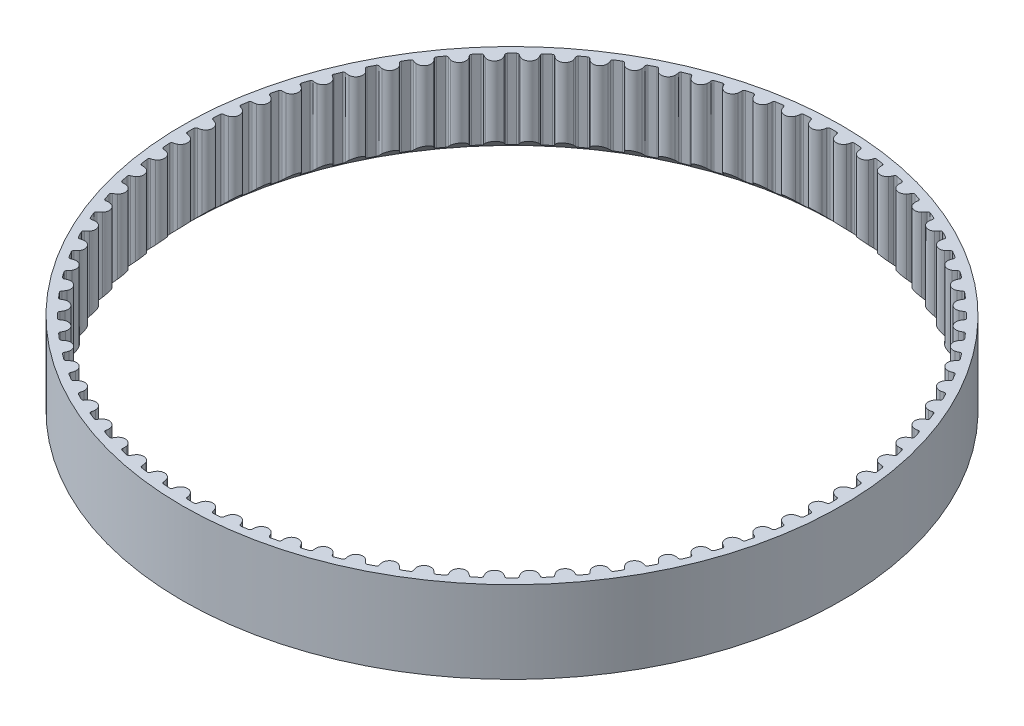
from build123d import *

# Parameters (mm, degrees)
BOSS_EXTRUDE3_OUTLINE_R = 26.0947905
BOSS_EXTRUDE3_DEPTH     = 6.5


# Read off the part's stored shape, not the designer's step: Boss-Extrude3
with BuildPart() as part:
    # Boss-Extrude3 outline → Boss-Extrude3 (new body)
    with BuildSketch(Plane(origin=(0, 0, 0), x_dir=(1, 0, 0), z_dir=(0, 1, 0))):
        Circle(BOSS_EXTRUDE3_OUTLINE_R)
        with BuildLine():
            ThreePointArc((-0.406440415, 25.311470509), (-0.357672827, 25.405419773), (-0.259013796, 25.443775182))
            ThreePointArc((-0.259013796, 25.443775182), (1.5e-08, 25.445093509), (0.259013826, 25.443775182))
            ThreePointArc((0.259013826, 25.443775182), (0.357672858, 25.405419773), (0.406440446, 25.311470509))
            ThreePointArc((0.406440446, 25.311470509), (0.434680636, 25.166341424), (0.484010949, 25.026962516))
            ThreePointArc((0.484010949, 25.026962516), (0.970298137, 24.695736292), (1.481073973, 24.987787803))
            ThreePointArc((1.481073973, 24.987787803), (1.541187761, 25.12286664), (1.580727593, 25.26533264))
            ThreePointArc((1.580727593, 25.26533264), (1.636716021, 25.355166029), (1.73808025, 25.385662503))
            ThreePointArc((1.73808025, 25.385662503), (1.996399043, 25.366654776), (2.254510966, 25.345018524))
            ThreePointArc((2.254510966, 25.345018524), (2.349856534, 25.299040654), (2.391102613, 25.201554743))
            ThreePointArc((2.391102613, 25.201554743), (2.407869051, 25.054657343), (2.446111753, 24.911837682))
            ThreePointArc((2.446111753, 24.911837682), (2.904912169, 24.543478864), (3.437027552, 24.794555068))
            ThreePointArc((3.437027552, 24.794555068), (3.507554192, 24.924501028), (3.55814989, 25.063425594))
            ThreePointArc((3.55814989, 25.063425594), (3.62101397, 25.148589255), (3.724458453, 25.171038773))
            ThreePointArc((3.724458453, 25.171038773), (3.980489606, 25.131822182), (4.236108296, 25.090001399))
            ThreePointArc((4.236108296, 25.090001399), (4.327552563, 25.036684536), (4.361022838, 24.936263011))
            ThreePointArc((4.361022838, 24.936263011), (4.366212154, 24.788502967), (4.393131464, 24.643123084))
            ThreePointArc((4.393131464, 24.643123084), (4.821616452, 24.239902728), (5.371790712, 24.448455656))
            ThreePointArc((5.371790712, 24.448455656), (5.452295385, 24.57246758), (5.513635009, 24.706994195))
            ThreePointArc((5.513635009, 24.706994195), (5.582987165, 24.786963066), (5.687874132, 24.801227218))
            ThreePointArc((5.687874132, 24.801227218), (5.940039128, 24.742043546), (6.191588609, 24.680296071))
            ThreePointArc((6.191588609, 24.680296071), (6.278567791, 24.619968932), (6.304055906, 24.517230926))
            ThreePointArc((6.304055906, 24.517230926), (6.297636106, 24.369519228), (6.313066059, 24.222475438))
            ThreePointArc((6.313066059, 24.222475438), (6.708593866, 23.78687953), (7.273434997, 23.951623384))
            ThreePointArc((7.273434997, 23.951623384), (7.363421364, 24.068936697), (7.435126735, 24.19823596))
            ThreePointArc((7.435126735, 24.19823596), (7.510539386, 24.272517007), (7.616222174, 24.278507851))
            ThreePointArc((7.616222174, 24.278507851), (7.862966332, 24.199721984), (8.10889572, 24.118428512))
            ThreePointArc((8.10889572, 24.118428512), (8.190873561, 24.051463033), (8.208222374, 23.94704196))
            ThreePointArc((8.208222374, 23.94704196), (8.190233037, 23.800289299), (8.194078503, 23.652488176))
            ThreePointArc((8.194078503, 23.652488176), (8.554210568, 23.187202311), (9.130236136, 23.30712139))
            ThreePointArc((9.130236136, 23.30712139), (9.229149402, 23.417012816), (9.310778432, 23.540287554))
            ThreePointArc((9.310778432, 23.540287554), (9.391786635, 23.608422809), (9.497613675, 23.606103409))
            ThreePointArc((9.497613675, 23.606103409), (9.737415735, 23.50820109), (9.976208792, 23.40786282))
            ThreePointArc((9.976208792, 23.40786282), (10.052679872, 23.334671866), (10.061782421, 23.229211516))
            ThreePointArc((10.061782421, 23.229211516), (10.032334459, 23.084322672), (10.024571727, 22.936675459))
            ThreePointArc((10.024571727, 22.936675459), (10.347087718, 22.444568279), (10.930746334, 22.518923242))
            ThreePointArc((10.930746334, 22.518923242), (11.037976665, 22.620715264), (11.129026084, 22.737205448))
            ThreePointArc((11.129026084, 22.737205448), (11.215130397, 22.798774833), (11.320449229, 22.78815949))
            ThreePointArc((11.320449229, 22.78815949), (11.551830732, 22.671744318), (11.782015219, 22.552979871))
            ThreePointArc((11.782015219, 22.552979871), (11.852508069, 22.474014688), (11.853308234, 22.368165259))
            ThreePointArc((11.853308234, 22.368165259), (11.812583202, 22.226033519), (11.793260133, 22.07945051))
            ThreePointArc((11.793260133, 22.07945051), (12.076171631, 21.56355602), (12.663864845, 21.591888444))
            ThreePointArc((12.663864845, 21.591888444), (12.778751131, 21.684953481), (12.87865959, 21.793940908))
            ThreePointArc((12.87865959, 21.793940908), (12.969329149, 21.84856483), (13.073490448, 21.82971899))
            ThreePointArc((13.073490448, 21.82971899), (13.29502485, 21.695508703), (13.515181605, 21.5590503))
            ThreePointArc((13.515181605, 21.5590503), (13.579261612, 21.474797736), (13.57175446, 21.369211825))
            ThreePointArc((13.57175446, 21.369211825), (13.520003442, 21.230713479), (13.489239169, 21.086098407))
            ThreePointArc((13.489239169, 21.086098407), (13.73080193, 20.549597267), (14.318906418, 20.531732474))
            ThreePointArc((14.318906418, 20.531732474), (14.440740346, 20.615496747), (14.548891876, 20.716309476))
            ThreePointArc((14.548891876, 20.716309476), (14.643567675, 20.763651159), (14.745929252, 20.736691013))
            ThreePointArc((14.745929252, 20.736691013), (14.95625072, 20.585513063), (15.165022402, 20.432202016))
            ThreePointArc((15.165022402, 20.432202016), (15.222294491, 20.343181514), (15.206526307, 20.238510094))
            ThreePointArc((15.206526307, 20.238510094), (15.144068365, 20.10449903), (15.10205256, 19.962743495))
            ThreePointArc((15.10205256, 19.962743495), (15.300777269, 19.408943414), (15.885667172, 19.344991545))
            ThreePointArc((15.885667172, 19.344991545), (16.013697596, 19.418938622), (16.129425407, 19.510955107))
            ThreePointArc((16.129425407, 19.510955107), (16.227523738, 19.550722674), (16.327454499, 19.51581444))
            ThreePointArc((16.327454499, 19.51581444), (16.525266331, 19.348600889), (16.721365793, 19.179382412))
            ThreePointArc((16.721365793, 19.179382412), (16.771476863, 19.086142815), (16.747544862, 18.983031219))
            ThreePointArc((16.747544862, 18.983031219), (16.67476507, 18.85433366), (16.621756775, 18.716311632))
            ThreePointArc((16.621756775, 18.716311632), (16.776418228, 18.14862697), (17.354487505, 18.038982311))
            ThreePointArc((17.354487505, 18.038982311), (17.487925075, 18.102656282), (17.610515665, 18.185309212))
            ThreePointArc((17.610515665, 18.185309212), (17.711431719, 18.217257482), (17.808315559, 18.174616382))
            ThreePointArc((17.808315559, 18.174616382), (17.992398179, 17.992398157), (18.174616403, 17.808315537))
            ThreePointArc((18.174616403, 17.808315537), (18.217257504, 17.711431697), (18.185309234, 17.610515643))
            ThreePointArc((18.185309234, 17.610515643), (18.102656304, 17.487925053), (18.038982332, 17.354487483))
            ThreePointArc((18.038982332, 17.354487483), (18.14862699, 16.776418206), (18.716311652, 16.621756752))
            ThreePointArc((18.716311652, 16.621756752), (18.854333681, 16.674765047), (18.983031239, 16.747544839))
            ThreePointArc((18.983031239, 16.747544839), (19.086142835, 16.77147684), (19.179382432, 16.72136577))
            ThreePointArc((19.179382432, 16.72136577), (19.348600909, 16.525266307), (19.51581446, 16.327454475))
            ThreePointArc((19.51581446, 16.327454475), (19.550722693, 16.227523714), (19.510955127, 16.129425383))
            ThreePointArc((19.510955127, 16.129425383), (19.418938642, 16.013697573), (19.344991565, 15.885667149))
            ThreePointArc((19.344991565, 15.885667149), (19.408943432, 15.300777245), (19.962743514, 15.102052536))
            ThreePointArc((19.962743514, 15.102052536), (20.104499049, 15.14406834), (20.238510113, 15.206526282))
            ThreePointArc((20.238510113, 15.206526282), (20.343181533, 15.222294467), (20.432202034, 15.165022377))
            ThreePointArc((20.432202034, 15.165022377), (20.585513081, 14.956250695), (20.736691031, 14.745929227))
            ThreePointArc((20.736691031, 14.745929227), (20.763651177, 14.64356765), (20.716309494, 14.548891851))
            ThreePointArc((20.716309494, 14.548891851), (20.615496765, 14.440740322), (20.531732491, 14.318906393))
            ThreePointArc((20.531732491, 14.318906393), (20.549597284, 13.730801905), (21.086098423, 13.489239144))
            ThreePointArc((21.086098423, 13.489239144), (21.230713496, 13.520003416), (21.369211842, 13.571754434))
            ThreePointArc((21.369211842, 13.571754434), (21.474797753, 13.579261586), (21.559050317, 13.515181579))
            ThreePointArc((21.559050317, 13.515181579), (21.695508719, 13.295024824), (21.829719005, 13.073490422))
            ThreePointArc((21.829719005, 13.073490422), (21.848564846, 12.969329123), (21.793940924, 12.878659563))
            ThreePointArc((21.793940924, 12.878659563), (21.684953496, 12.778751104), (21.59188846, 12.663864819))
            ThreePointArc((21.59188846, 12.663864819), (21.563556034, 12.076171605), (22.079450524, 11.793260107))
            ThreePointArc((22.079450524, 11.793260107), (22.226033534, 11.812583175), (22.368165274, 11.853308207))
            ThreePointArc((22.368165274, 11.853308207), (22.474014703, 11.852508041), (22.552979885, 11.782015192))
            ThreePointArc((22.552979885, 11.782015192), (22.671744332, 11.551830704), (22.788159504, 11.320449201))
            ThreePointArc((22.788159504, 11.320449201), (22.798774847, 11.215130369), (22.737205461, 11.129026057))
            ThreePointArc((22.737205461, 11.129026057), (22.620715278, 11.037976637), (22.518923256, 10.930746306))
            ThreePointArc((22.518923256, 10.930746306), (22.444568291, 10.34708769), (22.936675471, 10.024571699))
            ThreePointArc((22.936675471, 10.024571699), (23.084322684, 10.032334431), (23.229211528, 10.061782393))
            ThreePointArc((23.229211528, 10.061782393), (23.334671878, 10.052679844), (23.407862832, 9.976208763))
            ThreePointArc((23.407862832, 9.976208763), (23.508201102, 9.737415706), (23.606103421, 9.497613646))
            ThreePointArc((23.606103421, 9.497613646), (23.60842282, 9.391786607), (23.540287566, 9.310778404))
            ThreePointArc((23.540287566, 9.310778404), (23.417012828, 9.229149373), (23.307121401, 9.130236108))
            ThreePointArc((23.307121401, 9.130236108), (23.187202321, 8.55421054), (23.652488186, 8.194078474))
            ThreePointArc((23.652488186, 8.194078474), (23.800289309, 8.190233009), (23.947041969, 8.208222345))
            ThreePointArc((23.947041969, 8.208222345), (24.051463043, 8.190873532), (24.118428522, 8.10889569))
            ThreePointArc((24.118428522, 8.10889569), (24.199721994, 7.862966303), (24.27850786, 7.616222145))
            ThreePointArc((24.27850786, 7.616222145), (24.272517016, 7.510539357), (24.198235969, 7.435126706))
            ThreePointArc((24.198235969, 7.435126706), (24.068936706, 7.363421335), (23.951623393, 7.273434968))
            ThreePointArc((23.951623393, 7.273434968), (23.786879539, 6.708593838), (24.222475445, 6.31306603))
            ThreePointArc((24.222475445, 6.31306603), (24.369519235, 6.297636076), (24.517230934, 6.304055877))
            ThreePointArc((24.517230934, 6.304055877), (24.61996894, 6.278567761), (24.680296079, 6.191588579))
            ThreePointArc((24.680296079, 6.191588579), (24.742043553, 5.940039097), (24.801227225, 5.687874101))
            ThreePointArc((24.801227225, 5.687874101), (24.786963073, 5.582987134), (24.706994201, 5.513634979))
            ThreePointArc((24.706994201, 5.513634979), (24.572467586, 5.452295355), (24.448455662, 5.371790683))
            ThreePointArc((24.448455662, 5.371790683), (24.239902734, 4.821616423), (24.643123089, 4.393131434))
            ThreePointArc((24.643123089, 4.393131434), (24.788502972, 4.366212123), (24.936263016, 4.361022807))
            ThreePointArc((24.936263016, 4.361022807), (25.036684541, 4.327552532), (25.090001404, 4.236108265))
            ThreePointArc((25.090001404, 4.236108265), (25.131822186, 3.980489576), (25.171038777, 3.724458423))
            ThreePointArc((25.171038777, 3.724458423), (25.14858926, 3.62101394), (25.063425599, 3.558149859))
            ThreePointArc((25.063425599, 3.558149859), (24.924501033, 3.507554162), (24.794555072, 3.437027521))
            ThreePointArc((24.794555072, 3.437027521), (24.543478868, 2.904912139), (24.911837685, 2.446111723))
            ThreePointArc((24.911837685, 2.446111723), (25.054657346, 2.407869021), (25.201554746, 2.391102582))
            ThreePointArc((25.201554746, 2.391102582), (25.299040657, 2.349856503), (25.345018527, 2.254510935))
            ThreePointArc((25.345018527, 2.254510935), (25.366654779, 1.996399012), (25.385662505, 1.738080219))
            ThreePointArc((25.385662505, 1.738080219), (25.355166031, 1.63671599), (25.265332642, 1.580727562))
            ThreePointArc((25.265332642, 1.580727562), (25.122866642, 1.54118773), (24.987787805, 1.481073943))
            ThreePointArc((24.987787805, 1.481073943), (24.695736293, 0.970298107), (25.026962517, 0.484010919))
            ThreePointArc((25.026962517, 0.484010919), (25.166341424, 0.434680605), (25.311470509, 0.406440415))
            ThreePointArc((25.311470509, 0.406440415), (25.405419773, 0.357672827), (25.443775182, 0.259013796))
            ThreePointArc((25.443775182, 0.259013796), (25.445093509, -1.5e-08), (25.443775182, -0.259013826))
            ThreePointArc((25.443775182, -0.259013826), (25.405419773, -0.357672858), (25.311470509, -0.406440446))
            ThreePointArc((25.311470509, -0.406440446), (25.166341424, -0.434680636), (25.026962516, -0.484010949))
            ThreePointArc((25.026962516, -0.484010949), (24.695736292, -0.970298137), (24.987787803, -1.481073973))
            ThreePointArc((24.987787803, -1.481073973), (25.12286664, -1.541187761), (25.26533264, -1.580727593))
            ThreePointArc((25.26533264, -1.580727593), (25.355166029, -1.636716021), (25.385662503, -1.73808025))
            ThreePointArc((25.385662503, -1.73808025), (25.366654776, -1.996399043), (25.345018524, -2.254510966))
            ThreePointArc((25.345018524, -2.254510966), (25.299040654, -2.349856534), (25.201554743, -2.391102613))
            ThreePointArc((25.201554743, -2.391102613), (25.054657343, -2.407869051), (24.911837682, -2.446111753))
            ThreePointArc((24.911837682, -2.446111753), (24.543478864, -2.904912169), (24.794555068, -3.437027552))
            ThreePointArc((24.794555068, -3.437027552), (24.924501028, -3.507554192), (25.063425594, -3.55814989))
            ThreePointArc((25.063425594, -3.55814989), (25.148589255, -3.62101397), (25.171038773, -3.724458453))
            ThreePointArc((25.171038773, -3.724458453), (25.131822182, -3.980489606), (25.090001399, -4.236108296))
            ThreePointArc((25.090001399, -4.236108296), (25.036684536, -4.327552563), (24.936263011, -4.361022838))
            ThreePointArc((24.936263011, -4.361022838), (24.788502967, -4.366212154), (24.643123084, -4.393131464))
            ThreePointArc((24.643123084, -4.393131464), (24.239902728, -4.821616452), (24.448455656, -5.371790712))
            ThreePointArc((24.448455656, -5.371790712), (24.57246758, -5.452295385), (24.706994195, -5.513635009))
            ThreePointArc((24.706994195, -5.513635009), (24.786963066, -5.582987165), (24.801227218, -5.687874132))
            ThreePointArc((24.801227218, -5.687874132), (24.742043546, -5.940039128), (24.680296071, -6.191588609))
            ThreePointArc((24.680296071, -6.191588609), (24.619968932, -6.278567791), (24.517230926, -6.304055906))
            ThreePointArc((24.517230926, -6.304055906), (24.369519228, -6.297636106), (24.222475438, -6.313066059))
            ThreePointArc((24.222475438, -6.313066059), (23.78687953, -6.708593866), (23.951623384, -7.273434997))
            ThreePointArc((23.951623384, -7.273434997), (24.068936697, -7.363421364), (24.19823596, -7.435126735))
            ThreePointArc((24.19823596, -7.435126735), (24.272517007, -7.510539386), (24.278507851, -7.616222174))
            ThreePointArc((24.278507851, -7.616222174), (24.199721984, -7.862966332), (24.118428512, -8.10889572))
            ThreePointArc((24.118428512, -8.10889572), (24.051463033, -8.190873561), (23.94704196, -8.208222374))
            ThreePointArc((23.94704196, -8.208222374), (23.800289299, -8.190233037), (23.652488176, -8.194078503))
            ThreePointArc((23.652488176, -8.194078503), (23.187202311, -8.554210568), (23.30712139, -9.130236136))
            ThreePointArc((23.30712139, -9.130236136), (23.417012816, -9.229149402), (23.540287554, -9.310778432))
            ThreePointArc((23.540287554, -9.310778432), (23.608422809, -9.391786635), (23.606103409, -9.497613675))
            ThreePointArc((23.606103409, -9.497613675), (23.50820109, -9.737415735), (23.40786282, -9.976208792))
            ThreePointArc((23.40786282, -9.976208792), (23.334671866, -10.052679872), (23.229211516, -10.061782421))
            ThreePointArc((23.229211516, -10.061782421), (23.084322672, -10.032334459), (22.936675459, -10.024571727))
            ThreePointArc((22.936675459, -10.024571727), (22.444568279, -10.347087718), (22.518923242, -10.930746334))
            ThreePointArc((22.518923242, -10.930746334), (22.620715264, -11.037976665), (22.737205448, -11.129026084))
            ThreePointArc((22.737205448, -11.129026084), (22.798774833, -11.215130397), (22.78815949, -11.320449229))
            ThreePointArc((22.78815949, -11.320449229), (22.671744318, -11.551830732), (22.552979871, -11.782015219))
            ThreePointArc((22.552979871, -11.782015219), (22.474014688, -11.852508069), (22.368165259, -11.853308234))
            ThreePointArc((22.368165259, -11.853308234), (22.226033519, -11.812583202), (22.07945051, -11.793260133))
            ThreePointArc((22.07945051, -11.793260133), (21.56355602, -12.076171631), (21.591888444, -12.663864845))
            ThreePointArc((21.591888444, -12.663864845), (21.684953481, -12.778751131), (21.793940908, -12.87865959))
            ThreePointArc((21.793940908, -12.87865959), (21.84856483, -12.969329149), (21.82971899, -13.073490448))
            ThreePointArc((21.82971899, -13.073490448), (21.695508703, -13.29502485), (21.5590503, -13.515181605))
            ThreePointArc((21.5590503, -13.515181605), (21.474797736, -13.579261612), (21.369211825, -13.57175446))
            ThreePointArc((21.369211825, -13.57175446), (21.230713479, -13.520003442), (21.086098407, -13.489239169))
            ThreePointArc((21.086098407, -13.489239169), (20.549597267, -13.73080193), (20.531732474, -14.318906418))
            ThreePointArc((20.531732474, -14.318906418), (20.615496747, -14.440740346), (20.716309476, -14.548891876))
            ThreePointArc((20.716309476, -14.548891876), (20.763651159, -14.643567675), (20.736691013, -14.745929252))
            ThreePointArc((20.736691013, -14.745929252), (20.585513063, -14.95625072), (20.432202016, -15.165022402))
            ThreePointArc((20.432202016, -15.165022402), (20.343181514, -15.222294491), (20.238510094, -15.206526307))
            ThreePointArc((20.238510094, -15.206526307), (20.10449903, -15.144068365), (19.962743495, -15.10205256))
            ThreePointArc((19.962743495, -15.10205256), (19.408943414, -15.300777269), (19.344991545, -15.885667172))
            ThreePointArc((19.344991545, -15.885667172), (19.418938622, -16.013697596), (19.510955107, -16.129425407))
            ThreePointArc((19.510955107, -16.129425407), (19.550722674, -16.227523738), (19.51581444, -16.327454499))
            ThreePointArc((19.51581444, -16.327454499), (19.348600889, -16.525266331), (19.179382412, -16.721365793))
            ThreePointArc((19.179382412, -16.721365793), (19.086142815, -16.771476863), (18.983031219, -16.747544862))
            ThreePointArc((18.983031219, -16.747544862), (18.85433366, -16.67476507), (18.716311632, -16.621756775))
            ThreePointArc((18.716311632, -16.621756775), (18.14862697, -16.776418228), (18.038982311, -17.354487505))
            ThreePointArc((18.038982311, -17.354487505), (18.102656282, -17.487925075), (18.185309212, -17.610515665))
            ThreePointArc((18.185309212, -17.610515665), (18.217257482, -17.711431719), (18.174616382, -17.808315559))
            ThreePointArc((18.174616382, -17.808315559), (17.992398157, -17.992398179), (17.808315537, -18.174616403))
            ThreePointArc((17.808315537, -18.174616403), (17.711431697, -18.217257504), (17.610515643, -18.185309234))
            ThreePointArc((17.610515643, -18.185309234), (17.487925053, -18.102656304), (17.354487483, -18.038982332))
            ThreePointArc((17.354487483, -18.038982332), (16.776418206, -18.14862699), (16.621756752, -18.716311652))
            ThreePointArc((16.621756752, -18.716311652), (16.674765047, -18.854333681), (16.747544839, -18.983031239))
            ThreePointArc((16.747544839, -18.983031239), (16.77147684, -19.086142835), (16.72136577, -19.179382432))
            ThreePointArc((16.72136577, -19.179382432), (16.525266307, -19.348600909), (16.327454475, -19.51581446))
            ThreePointArc((16.327454475, -19.51581446), (16.227523714, -19.550722693), (16.129425383, -19.510955127))
            ThreePointArc((16.129425383, -19.510955127), (16.013697573, -19.418938642), (15.885667149, -19.344991565))
            ThreePointArc((15.885667149, -19.344991565), (15.300777245, -19.408943432), (15.102052536, -19.962743514))
            ThreePointArc((15.102052536, -19.962743514), (15.14406834, -20.104499049), (15.206526282, -20.238510113))
            ThreePointArc((15.206526282, -20.238510113), (15.222294467, -20.343181533), (15.165022377, -20.432202034))
            ThreePointArc((15.165022377, -20.432202034), (14.956250695, -20.585513081), (14.745929227, -20.736691031))
            ThreePointArc((14.745929227, -20.736691031), (14.64356765, -20.763651177), (14.548891851, -20.716309494))
            ThreePointArc((14.548891851, -20.716309494), (14.440740322, -20.615496765), (14.318906393, -20.531732491))
            ThreePointArc((14.318906393, -20.531732491), (13.730801905, -20.549597284), (13.489239144, -21.086098423))
            ThreePointArc((13.489239144, -21.086098423), (13.520003416, -21.230713496), (13.571754434, -21.369211842))
            ThreePointArc((13.571754434, -21.369211842), (13.579261586, -21.474797753), (13.515181579, -21.559050317))
            ThreePointArc((13.515181579, -21.559050317), (13.295024824, -21.695508719), (13.073490422, -21.829719005))
            ThreePointArc((13.073490422, -21.829719005), (12.969329123, -21.848564846), (12.878659563, -21.793940924))
            ThreePointArc((12.878659563, -21.793940924), (12.778751104, -21.684953496), (12.663864819, -21.59188846))
            ThreePointArc((12.663864819, -21.59188846), (12.076171605, -21.563556034), (11.793260107, -22.079450524))
            ThreePointArc((11.793260107, -22.079450524), (11.812583175, -22.226033534), (11.853308207, -22.368165274))
            ThreePointArc((11.853308207, -22.368165274), (11.852508041, -22.474014703), (11.782015192, -22.552979885))
            ThreePointArc((11.782015192, -22.552979885), (11.551830704, -22.671744332), (11.320449201, -22.788159504))
            ThreePointArc((11.320449201, -22.788159504), (11.215130369, -22.798774847), (11.129026057, -22.737205461))
            ThreePointArc((11.129026057, -22.737205461), (11.037976637, -22.620715278), (10.930746306, -22.518923256))
            ThreePointArc((10.930746306, -22.518923256), (10.34708769, -22.444568291), (10.024571699, -22.936675471))
            ThreePointArc((10.024571699, -22.936675471), (10.032334431, -23.084322684), (10.061782393, -23.229211528))
            ThreePointArc((10.061782393, -23.229211528), (10.052679844, -23.334671878), (9.976208763, -23.407862832))
            ThreePointArc((9.976208763, -23.407862832), (9.737415706, -23.508201102), (9.497613646, -23.606103421))
            ThreePointArc((9.497613646, -23.606103421), (9.391786607, -23.60842282), (9.310778404, -23.540287566))
            ThreePointArc((9.310778404, -23.540287566), (9.229149373, -23.417012828), (9.130236108, -23.307121401))
            ThreePointArc((9.130236108, -23.307121401), (8.55421054, -23.187202321), (8.194078474, -23.652488186))
            ThreePointArc((8.194078474, -23.652488186), (8.190233009, -23.800289309), (8.208222345, -23.947041969))
            ThreePointArc((8.208222345, -23.947041969), (8.190873532, -24.051463043), (8.10889569, -24.118428522))
            ThreePointArc((8.10889569, -24.118428522), (7.862966303, -24.199721994), (7.616222145, -24.27850786))
            ThreePointArc((7.616222145, -24.27850786), (7.510539357, -24.272517016), (7.435126706, -24.198235969))
            ThreePointArc((7.435126706, -24.198235969), (7.363421335, -24.068936706), (7.273434968, -23.951623393))
            ThreePointArc((7.273434968, -23.951623393), (6.708593838, -23.786879539), (6.31306603, -24.222475445))
            ThreePointArc((6.31306603, -24.222475445), (6.297636076, -24.369519235), (6.304055877, -24.517230934))
            ThreePointArc((6.304055877, -24.517230934), (6.278567761, -24.61996894), (6.191588579, -24.680296079))
            ThreePointArc((6.191588579, -24.680296079), (5.940039097, -24.742043553), (5.687874101, -24.801227225))
            ThreePointArc((5.687874101, -24.801227225), (5.582987134, -24.786963073), (5.513634979, -24.706994201))
            ThreePointArc((5.513634979, -24.706994201), (5.452295355, -24.572467586), (5.371790683, -24.448455662))
            ThreePointArc((5.371790683, -24.448455662), (4.821616423, -24.239902734), (4.393131434, -24.643123089))
            ThreePointArc((4.393131434, -24.643123089), (4.366212123, -24.788502972), (4.361022807, -24.936263016))
            ThreePointArc((4.361022807, -24.936263016), (4.327552532, -25.036684541), (4.236108265, -25.090001404))
            ThreePointArc((4.236108265, -25.090001404), (3.980489576, -25.131822186), (3.724458423, -25.171038777))
            ThreePointArc((3.724458423, -25.171038777), (3.62101394, -25.14858926), (3.558149859, -25.063425599))
            ThreePointArc((3.558149859, -25.063425599), (3.507554162, -24.924501033), (3.437027521, -24.794555072))
            ThreePointArc((3.437027521, -24.794555072), (2.904912139, -24.543478868), (2.446111723, -24.911837685))
            ThreePointArc((2.446111723, -24.911837685), (2.407869021, -25.054657346), (2.391102582, -25.201554746))
            ThreePointArc((2.391102582, -25.201554746), (2.349856503, -25.299040657), (2.254510935, -25.345018527))
            ThreePointArc((2.254510935, -25.345018527), (1.996399012, -25.366654779), (1.738080219, -25.385662505))
            ThreePointArc((1.738080219, -25.385662505), (1.63671599, -25.355166031), (1.580727562, -25.265332642))
            ThreePointArc((1.580727562, -25.265332642), (1.54118773, -25.122866642), (1.481073943, -24.987787805))
            ThreePointArc((1.481073943, -24.987787805), (0.970298107, -24.695736293), (0.484010919, -25.026962517))
            ThreePointArc((0.484010919, -25.026962517), (0.434680605, -25.166341424), (0.406440415, -25.311470509))
            ThreePointArc((0.406440415, -25.311470509), (0.357672827, -25.405419773), (0.259013796, -25.443775182))
            ThreePointArc((0.259013796, -25.443775182), (-1.5e-08, -25.445093509), (-0.259013826, -25.443775182))
            ThreePointArc((-0.259013826, -25.443775182), (-0.357672858, -25.405419773), (-0.406440446, -25.311470509))
            ThreePointArc((-0.406440446, -25.311470509), (-0.434680636, -25.166341424), (-0.484010949, -25.026962516))
            ThreePointArc((-0.484010949, -25.026962516), (-0.970298137, -24.695736292), (-1.481073973, -24.987787803))
            ThreePointArc((-1.481073973, -24.987787803), (-1.541187761, -25.12286664), (-1.580727593, -25.26533264))
            ThreePointArc((-1.580727593, -25.26533264), (-1.636716021, -25.355166029), (-1.73808025, -25.385662503))
            ThreePointArc((-1.73808025, -25.385662503), (-1.996399043, -25.366654776), (-2.254510966, -25.345018524))
            ThreePointArc((-2.254510966, -25.345018524), (-2.349856534, -25.299040654), (-2.391102613, -25.201554743))
            ThreePointArc((-2.391102613, -25.201554743), (-2.407869051, -25.054657343), (-2.446111753, -24.911837682))
            ThreePointArc((-2.446111753, -24.911837682), (-2.904912169, -24.543478864), (-3.437027552, -24.794555068))
            ThreePointArc((-3.437027552, -24.794555068), (-3.507554192, -24.924501028), (-3.55814989, -25.063425594))
            ThreePointArc((-3.55814989, -25.063425594), (-3.62101397, -25.148589255), (-3.724458453, -25.171038773))
            ThreePointArc((-3.724458453, -25.171038773), (-3.980489606, -25.131822182), (-4.236108296, -25.090001399))
            ThreePointArc((-4.236108296, -25.090001399), (-4.327552563, -25.036684536), (-4.361022838, -24.936263011))
            ThreePointArc((-4.361022838, -24.936263011), (-4.366212154, -24.788502967), (-4.393131464, -24.643123084))
            ThreePointArc((-4.393131464, -24.643123084), (-4.821616452, -24.239902728), (-5.371790712, -24.448455656))
            ThreePointArc((-5.371790712, -24.448455656), (-5.452295385, -24.57246758), (-5.513635009, -24.706994195))
            ThreePointArc((-5.513635009, -24.706994195), (-5.582987165, -24.786963066), (-5.687874132, -24.801227218))
            ThreePointArc((-5.687874132, -24.801227218), (-5.940039128, -24.742043546), (-6.191588609, -24.680296071))
            ThreePointArc((-6.191588609, -24.680296071), (-6.278567791, -24.619968932), (-6.304055906, -24.517230926))
            ThreePointArc((-6.304055906, -24.517230926), (-6.297636106, -24.369519228), (-6.313066059, -24.222475438))
            ThreePointArc((-6.313066059, -24.222475438), (-6.708593866, -23.78687953), (-7.273434997, -23.951623384))
            ThreePointArc((-7.273434997, -23.951623384), (-7.363421364, -24.068936697), (-7.435126735, -24.19823596))
            ThreePointArc((-7.435126735, -24.19823596), (-7.510539386, -24.272517007), (-7.616222174, -24.278507851))
            ThreePointArc((-7.616222174, -24.278507851), (-7.862966332, -24.199721984), (-8.10889572, -24.118428512))
            ThreePointArc((-8.10889572, -24.118428512), (-8.190873561, -24.051463033), (-8.208222374, -23.94704196))
            ThreePointArc((-8.208222374, -23.94704196), (-8.190233037, -23.800289299), (-8.194078503, -23.652488176))
            ThreePointArc((-8.194078503, -23.652488176), (-8.554210568, -23.187202311), (-9.130236136, -23.30712139))
            ThreePointArc((-9.130236136, -23.30712139), (-9.229149402, -23.417012816), (-9.310778432, -23.540287554))
            ThreePointArc((-9.310778432, -23.540287554), (-9.391786635, -23.608422809), (-9.497613675, -23.606103409))
            ThreePointArc((-9.497613675, -23.606103409), (-9.737415735, -23.50820109), (-9.976208792, -23.40786282))
            ThreePointArc((-9.976208792, -23.40786282), (-10.052679872, -23.334671866), (-10.061782421, -23.229211516))
            ThreePointArc((-10.061782421, -23.229211516), (-10.032334459, -23.084322672), (-10.024571727, -22.936675459))
            ThreePointArc((-10.024571727, -22.936675459), (-10.347087718, -22.444568279), (-10.930746334, -22.518923242))
            ThreePointArc((-10.930746334, -22.518923242), (-11.037976665, -22.620715264), (-11.129026084, -22.737205448))
            ThreePointArc((-11.129026084, -22.737205448), (-11.215130397, -22.798774833), (-11.320449229, -22.78815949))
            ThreePointArc((-11.320449229, -22.78815949), (-11.551830732, -22.671744318), (-11.782015219, -22.552979871))
            ThreePointArc((-11.782015219, -22.552979871), (-11.852508069, -22.474014688), (-11.853308234, -22.368165259))
            ThreePointArc((-11.853308234, -22.368165259), (-11.812583202, -22.226033519), (-11.793260133, -22.07945051))
            ThreePointArc((-11.793260133, -22.07945051), (-12.076171631, -21.56355602), (-12.663864845, -21.591888444))
            ThreePointArc((-12.663864845, -21.591888444), (-12.778751131, -21.684953481), (-12.87865959, -21.793940908))
            ThreePointArc((-12.87865959, -21.793940908), (-12.969329149, -21.84856483), (-13.073490448, -21.82971899))
            ThreePointArc((-13.073490448, -21.82971899), (-13.29502485, -21.695508703), (-13.515181605, -21.5590503))
            ThreePointArc((-13.515181605, -21.5590503), (-13.579261612, -21.474797736), (-13.57175446, -21.369211825))
            ThreePointArc((-13.57175446, -21.369211825), (-13.520003442, -21.230713479), (-13.489239169, -21.086098407))
            ThreePointArc((-13.489239169, -21.086098407), (-13.73080193, -20.549597267), (-14.318906418, -20.531732474))
            ThreePointArc((-14.318906418, -20.531732474), (-14.440740346, -20.615496747), (-14.548891876, -20.716309476))
            ThreePointArc((-14.548891876, -20.716309476), (-14.643567675, -20.763651159), (-14.745929252, -20.736691013))
            ThreePointArc((-14.745929252, -20.736691013), (-14.95625072, -20.585513063), (-15.165022402, -20.432202016))
            ThreePointArc((-15.165022402, -20.432202016), (-15.222294491, -20.343181514), (-15.206526307, -20.238510094))
            ThreePointArc((-15.206526307, -20.238510094), (-15.144068365, -20.10449903), (-15.10205256, -19.962743495))
            ThreePointArc((-15.10205256, -19.962743495), (-15.300777269, -19.408943414), (-15.885667172, -19.344991545))
            ThreePointArc((-15.885667172, -19.344991545), (-16.013697596, -19.418938622), (-16.129425407, -19.510955107))
            ThreePointArc((-16.129425407, -19.510955107), (-16.227523738, -19.550722674), (-16.327454499, -19.51581444))
            ThreePointArc((-16.327454499, -19.51581444), (-16.525266331, -19.348600889), (-16.721365793, -19.179382412))
            ThreePointArc((-16.721365793, -19.179382412), (-16.771476863, -19.086142815), (-16.747544862, -18.983031219))
            ThreePointArc((-16.747544862, -18.983031219), (-16.67476507, -18.85433366), (-16.621756775, -18.716311632))
            ThreePointArc((-16.621756775, -18.716311632), (-16.776418228, -18.14862697), (-17.354487505, -18.038982311))
            ThreePointArc((-17.354487505, -18.038982311), (-17.487925075, -18.102656282), (-17.610515665, -18.185309212))
            ThreePointArc((-17.610515665, -18.185309212), (-17.711431719, -18.217257482), (-17.808315559, -18.174616382))
            ThreePointArc((-17.808315559, -18.174616382), (-17.992398179, -17.992398157), (-18.174616403, -17.808315537))
            ThreePointArc((-18.174616403, -17.808315537), (-18.217257504, -17.711431697), (-18.185309234, -17.610515643))
            ThreePointArc((-18.185309234, -17.610515643), (-18.102656304, -17.487925053), (-18.038982332, -17.354487483))
            ThreePointArc((-18.038982332, -17.354487483), (-18.14862699, -16.776418206), (-18.716311652, -16.621756752))
            ThreePointArc((-18.716311652, -16.621756752), (-18.854333681, -16.674765047), (-18.983031239, -16.747544839))
            ThreePointArc((-18.983031239, -16.747544839), (-19.086142835, -16.77147684), (-19.179382432, -16.72136577))
            ThreePointArc((-19.179382432, -16.72136577), (-19.348600909, -16.525266307), (-19.51581446, -16.327454475))
            ThreePointArc((-19.51581446, -16.327454475), (-19.550722693, -16.227523714), (-19.510955127, -16.129425383))
            ThreePointArc((-19.510955127, -16.129425383), (-19.418938642, -16.013697573), (-19.344991565, -15.885667149))
            ThreePointArc((-19.344991565, -15.885667149), (-19.408943432, -15.300777245), (-19.962743514, -15.102052536))
            ThreePointArc((-19.962743514, -15.102052536), (-20.104499049, -15.14406834), (-20.238510113, -15.206526282))
            ThreePointArc((-20.238510113, -15.206526282), (-20.343181533, -15.222294467), (-20.432202034, -15.165022377))
            ThreePointArc((-20.432202034, -15.165022377), (-20.585513081, -14.956250695), (-20.736691031, -14.745929227))
            ThreePointArc((-20.736691031, -14.745929227), (-20.763651177, -14.64356765), (-20.716309494, -14.548891851))
            ThreePointArc((-20.716309494, -14.548891851), (-20.615496765, -14.440740322), (-20.531732491, -14.318906393))
            ThreePointArc((-20.531732491, -14.318906393), (-20.549597284, -13.730801905), (-21.086098423, -13.489239144))
            ThreePointArc((-21.086098423, -13.489239144), (-21.230713496, -13.520003416), (-21.369211842, -13.571754434))
            ThreePointArc((-21.369211842, -13.571754434), (-21.474797753, -13.579261586), (-21.559050317, -13.515181579))
            ThreePointArc((-21.559050317, -13.515181579), (-21.695508719, -13.295024824), (-21.829719005, -13.073490422))
            ThreePointArc((-21.829719005, -13.073490422), (-21.848564846, -12.969329123), (-21.793940924, -12.878659563))
            ThreePointArc((-21.793940924, -12.878659563), (-21.684953496, -12.778751104), (-21.59188846, -12.663864819))
            ThreePointArc((-21.59188846, -12.663864819), (-21.563556034, -12.076171605), (-22.079450524, -11.793260107))
            ThreePointArc((-22.079450524, -11.793260107), (-22.226033534, -11.812583175), (-22.368165274, -11.853308207))
            ThreePointArc((-22.368165274, -11.853308207), (-22.474014703, -11.852508041), (-22.552979885, -11.782015192))
            ThreePointArc((-22.552979885, -11.782015192), (-22.671744332, -11.551830704), (-22.788159504, -11.320449201))
            ThreePointArc((-22.788159504, -11.320449201), (-22.798774847, -11.215130369), (-22.737205461, -11.129026057))
            ThreePointArc((-22.737205461, -11.129026057), (-22.620715278, -11.037976637), (-22.518923256, -10.930746306))
            ThreePointArc((-22.518923256, -10.930746306), (-22.444568291, -10.34708769), (-22.936675471, -10.024571699))
            ThreePointArc((-22.936675471, -10.024571699), (-23.084322684, -10.032334431), (-23.229211528, -10.061782393))
            ThreePointArc((-23.229211528, -10.061782393), (-23.334671878, -10.052679844), (-23.407862832, -9.976208763))
            ThreePointArc((-23.407862832, -9.976208763), (-23.508201102, -9.737415706), (-23.606103421, -9.497613646))
            ThreePointArc((-23.606103421, -9.497613646), (-23.60842282, -9.391786607), (-23.540287566, -9.310778404))
            ThreePointArc((-23.540287566, -9.310778404), (-23.417012828, -9.229149373), (-23.307121401, -9.130236108))
            ThreePointArc((-23.307121401, -9.130236108), (-23.187202321, -8.55421054), (-23.652488186, -8.194078474))
            ThreePointArc((-23.652488186, -8.194078474), (-23.800289309, -8.190233009), (-23.947041969, -8.208222345))
            ThreePointArc((-23.947041969, -8.208222345), (-24.051463043, -8.190873532), (-24.118428522, -8.10889569))
            ThreePointArc((-24.118428522, -8.10889569), (-24.199721994, -7.862966303), (-24.27850786, -7.616222145))
            ThreePointArc((-24.27850786, -7.616222145), (-24.272517016, -7.510539357), (-24.198235969, -7.435126706))
            ThreePointArc((-24.198235969, -7.435126706), (-24.068936706, -7.363421335), (-23.951623393, -7.273434968))
            ThreePointArc((-23.951623393, -7.273434968), (-23.786879539, -6.708593838), (-24.222475445, -6.31306603))
            ThreePointArc((-24.222475445, -6.31306603), (-24.369519235, -6.297636076), (-24.517230934, -6.304055877))
            ThreePointArc((-24.517230934, -6.304055877), (-24.61996894, -6.278567761), (-24.680296079, -6.191588579))
            ThreePointArc((-24.680296079, -6.191588579), (-24.742043553, -5.940039097), (-24.801227225, -5.687874101))
            ThreePointArc((-24.801227225, -5.687874101), (-24.786963073, -5.582987134), (-24.706994201, -5.513634979))
            ThreePointArc((-24.706994201, -5.513634979), (-24.572467586, -5.452295355), (-24.448455662, -5.371790683))
            ThreePointArc((-24.448455662, -5.371790683), (-24.239902734, -4.821616423), (-24.643123089, -4.393131434))
            ThreePointArc((-24.643123089, -4.393131434), (-24.788502972, -4.366212123), (-24.936263016, -4.361022807))
            ThreePointArc((-24.936263016, -4.361022807), (-25.036684541, -4.327552532), (-25.090001404, -4.236108265))
            ThreePointArc((-25.090001404, -4.236108265), (-25.131822186, -3.980489576), (-25.171038777, -3.724458423))
            ThreePointArc((-25.171038777, -3.724458423), (-25.14858926, -3.62101394), (-25.063425599, -3.558149859))
            ThreePointArc((-25.063425599, -3.558149859), (-24.924501033, -3.507554162), (-24.794555072, -3.437027521))
            ThreePointArc((-24.794555072, -3.437027521), (-24.543478868, -2.904912139), (-24.911837685, -2.446111723))
            ThreePointArc((-24.911837685, -2.446111723), (-25.054657346, -2.407869021), (-25.201554746, -2.391102582))
            ThreePointArc((-25.201554746, -2.391102582), (-25.299040657, -2.349856503), (-25.345018527, -2.254510935))
            ThreePointArc((-25.345018527, -2.254510935), (-25.366654779, -1.996399012), (-25.385662505, -1.738080219))
            ThreePointArc((-25.385662505, -1.738080219), (-25.355166031, -1.63671599), (-25.265332642, -1.580727562))
            ThreePointArc((-25.265332642, -1.580727562), (-25.122866642, -1.54118773), (-24.987787805, -1.481073943))
            ThreePointArc((-24.987787805, -1.481073943), (-24.695736293, -0.970298107), (-25.026962517, -0.484010919))
            ThreePointArc((-25.026962517, -0.484010919), (-25.166341424, -0.434680605), (-25.311470509, -0.406440415))
            ThreePointArc((-25.311470509, -0.406440415), (-25.405419773, -0.357672827), (-25.443775182, -0.259013796))
            ThreePointArc((-25.443775182, -0.259013796), (-25.445093509, 1.5e-08), (-25.443775182, 0.259013826))
            ThreePointArc((-25.443775182, 0.259013826), (-25.405419773, 0.357672858), (-25.311470509, 0.406440446))
            ThreePointArc((-25.311470509, 0.406440446), (-25.166341424, 0.434680636), (-25.026962516, 0.484010949))
            ThreePointArc((-25.026962516, 0.484010949), (-24.695736292, 0.970298137), (-24.987787803, 1.481073973))
            ThreePointArc((-24.987787803, 1.481073973), (-25.12286664, 1.541187761), (-25.26533264, 1.580727593))
            ThreePointArc((-25.26533264, 1.580727593), (-25.355166029, 1.636716021), (-25.385662503, 1.73808025))
            ThreePointArc((-25.385662503, 1.73808025), (-25.366654776, 1.996399043), (-25.345018524, 2.254510966))
            ThreePointArc((-25.345018524, 2.254510966), (-25.299040654, 2.349856534), (-25.201554743, 2.391102613))
            ThreePointArc((-25.201554743, 2.391102613), (-25.054657343, 2.407869051), (-24.911837682, 2.446111753))
            ThreePointArc((-24.911837682, 2.446111753), (-24.543478864, 2.904912169), (-24.794555068, 3.437027552))
            ThreePointArc((-24.794555068, 3.437027552), (-24.924501028, 3.507554192), (-25.063425594, 3.55814989))
            ThreePointArc((-25.063425594, 3.55814989), (-25.148589255, 3.62101397), (-25.171038773, 3.724458453))
            ThreePointArc((-25.171038773, 3.724458453), (-25.131822182, 3.980489606), (-25.090001399, 4.236108296))
            ThreePointArc((-25.090001399, 4.236108296), (-25.036684536, 4.327552563), (-24.936263011, 4.361022838))
            ThreePointArc((-24.936263011, 4.361022838), (-24.788502967, 4.366212154), (-24.643123084, 4.393131464))
            ThreePointArc((-24.643123084, 4.393131464), (-24.239902728, 4.821616452), (-24.448455656, 5.371790712))
            ThreePointArc((-24.448455656, 5.371790712), (-24.57246758, 5.452295385), (-24.706994195, 5.513635009))
            ThreePointArc((-24.706994195, 5.513635009), (-24.786963066, 5.582987165), (-24.801227218, 5.687874132))
            ThreePointArc((-24.801227218, 5.687874132), (-24.742043546, 5.940039128), (-24.680296071, 6.191588609))
            ThreePointArc((-24.680296071, 6.191588609), (-24.619968932, 6.278567791), (-24.517230926, 6.304055906))
            ThreePointArc((-24.517230926, 6.304055906), (-24.369519228, 6.297636106), (-24.222475438, 6.313066059))
            ThreePointArc((-24.222475438, 6.313066059), (-23.78687953, 6.708593866), (-23.951623384, 7.273434997))
            ThreePointArc((-23.951623384, 7.273434997), (-24.068936697, 7.363421364), (-24.19823596, 7.435126735))
            ThreePointArc((-24.19823596, 7.435126735), (-24.272517007, 7.510539386), (-24.278507851, 7.616222174))
            ThreePointArc((-24.278507851, 7.616222174), (-24.199721984, 7.862966332), (-24.118428512, 8.10889572))
            ThreePointArc((-24.118428512, 8.10889572), (-24.051463033, 8.190873561), (-23.94704196, 8.208222374))
            ThreePointArc((-23.94704196, 8.208222374), (-23.800289299, 8.190233037), (-23.652488176, 8.194078503))
            ThreePointArc((-23.652488176, 8.194078503), (-23.187202311, 8.554210568), (-23.30712139, 9.130236136))
            ThreePointArc((-23.30712139, 9.130236136), (-23.417012816, 9.229149402), (-23.540287554, 9.310778432))
            ThreePointArc((-23.540287554, 9.310778432), (-23.608422809, 9.391786635), (-23.606103409, 9.497613675))
            ThreePointArc((-23.606103409, 9.497613675), (-23.50820109, 9.737415735), (-23.40786282, 9.976208792))
            ThreePointArc((-23.40786282, 9.976208792), (-23.334671866, 10.052679872), (-23.229211516, 10.061782421))
            ThreePointArc((-23.229211516, 10.061782421), (-23.084322672, 10.032334459), (-22.936675459, 10.024571727))
            ThreePointArc((-22.936675459, 10.024571727), (-22.444568279, 10.347087718), (-22.518923242, 10.930746334))
            ThreePointArc((-22.518923242, 10.930746334), (-22.620715264, 11.037976665), (-22.737205448, 11.129026084))
            ThreePointArc((-22.737205448, 11.129026084), (-22.798774833, 11.215130397), (-22.78815949, 11.320449229))
            ThreePointArc((-22.78815949, 11.320449229), (-22.671744318, 11.551830732), (-22.552979871, 11.782015219))
            ThreePointArc((-22.552979871, 11.782015219), (-22.474014688, 11.852508069), (-22.368165259, 11.853308234))
            ThreePointArc((-22.368165259, 11.853308234), (-22.226033519, 11.812583202), (-22.07945051, 11.793260133))
            ThreePointArc((-22.07945051, 11.793260133), (-21.56355602, 12.076171631), (-21.591888444, 12.663864845))
            ThreePointArc((-21.591888444, 12.663864845), (-21.684953481, 12.778751131), (-21.793940908, 12.87865959))
            ThreePointArc((-21.793940908, 12.87865959), (-21.84856483, 12.969329149), (-21.82971899, 13.073490448))
            ThreePointArc((-21.82971899, 13.073490448), (-21.695508703, 13.29502485), (-21.5590503, 13.515181605))
            ThreePointArc((-21.5590503, 13.515181605), (-21.474797736, 13.579261612), (-21.369211825, 13.57175446))
            ThreePointArc((-21.369211825, 13.57175446), (-21.230713479, 13.520003442), (-21.086098407, 13.489239169))
            ThreePointArc((-21.086098407, 13.489239169), (-20.549597267, 13.73080193), (-20.531732474, 14.318906418))
            ThreePointArc((-20.531732474, 14.318906418), (-20.615496747, 14.440740346), (-20.716309476, 14.548891876))
            ThreePointArc((-20.716309476, 14.548891876), (-20.763651159, 14.643567675), (-20.736691013, 14.745929252))
            ThreePointArc((-20.736691013, 14.745929252), (-20.585513063, 14.95625072), (-20.432202016, 15.165022402))
            ThreePointArc((-20.432202016, 15.165022402), (-20.343181514, 15.222294491), (-20.238510094, 15.206526307))
            ThreePointArc((-20.238510094, 15.206526307), (-20.10449903, 15.144068365), (-19.962743495, 15.10205256))
            ThreePointArc((-19.962743495, 15.10205256), (-19.408943414, 15.300777269), (-19.344991545, 15.885667172))
            ThreePointArc((-19.344991545, 15.885667172), (-19.418938622, 16.013697596), (-19.510955107, 16.129425407))
            ThreePointArc((-19.510955107, 16.129425407), (-19.550722674, 16.227523738), (-19.51581444, 16.327454499))
            ThreePointArc((-19.51581444, 16.327454499), (-19.348600889, 16.525266331), (-19.179382412, 16.721365793))
            ThreePointArc((-19.179382412, 16.721365793), (-19.086142815, 16.771476863), (-18.983031219, 16.747544862))
            ThreePointArc((-18.983031219, 16.747544862), (-18.85433366, 16.67476507), (-18.716311632, 16.621756775))
            ThreePointArc((-18.716311632, 16.621756775), (-18.14862697, 16.776418228), (-18.038982311, 17.354487505))
            ThreePointArc((-18.038982311, 17.354487505), (-18.102656282, 17.487925075), (-18.185309212, 17.610515665))
            ThreePointArc((-18.185309212, 17.610515665), (-18.217257482, 17.711431719), (-18.174616382, 17.808315559))
            ThreePointArc((-18.174616382, 17.808315559), (-17.992398157, 17.992398179), (-17.808315537, 18.174616403))
            ThreePointArc((-17.808315537, 18.174616403), (-17.711431697, 18.217257504), (-17.610515643, 18.185309234))
            ThreePointArc((-17.610515643, 18.185309234), (-17.487925053, 18.102656304), (-17.354487483, 18.038982332))
            ThreePointArc((-17.354487483, 18.038982332), (-16.776418206, 18.14862699), (-16.621756752, 18.716311652))
            ThreePointArc((-16.621756752, 18.716311652), (-16.674765047, 18.854333681), (-16.747544839, 18.983031239))
            ThreePointArc((-16.747544839, 18.983031239), (-16.77147684, 19.086142835), (-16.72136577, 19.179382432))
            ThreePointArc((-16.72136577, 19.179382432), (-16.525266307, 19.348600909), (-16.327454475, 19.51581446))
            ThreePointArc((-16.327454475, 19.51581446), (-16.227523714, 19.550722693), (-16.129425383, 19.510955127))
            ThreePointArc((-16.129425383, 19.510955127), (-16.013697573, 19.418938642), (-15.885667149, 19.344991565))
            ThreePointArc((-15.885667149, 19.344991565), (-15.300777245, 19.408943432), (-15.102052536, 19.962743514))
            ThreePointArc((-15.102052536, 19.962743514), (-15.14406834, 20.104499049), (-15.206526282, 20.238510113))
            ThreePointArc((-15.206526282, 20.238510113), (-15.222294467, 20.343181533), (-15.165022377, 20.432202034))
            ThreePointArc((-15.165022377, 20.432202034), (-14.956250695, 20.585513081), (-14.745929227, 20.736691031))
            ThreePointArc((-14.745929227, 20.736691031), (-14.64356765, 20.763651177), (-14.548891851, 20.716309494))
            ThreePointArc((-14.548891851, 20.716309494), (-14.440740322, 20.615496765), (-14.318906393, 20.531732491))
            ThreePointArc((-14.318906393, 20.531732491), (-13.730801905, 20.549597284), (-13.489239144, 21.086098423))
            ThreePointArc((-13.489239144, 21.086098423), (-13.520003416, 21.230713496), (-13.571754434, 21.369211842))
            ThreePointArc((-13.571754434, 21.369211842), (-13.579261586, 21.474797753), (-13.515181579, 21.559050317))
            ThreePointArc((-13.515181579, 21.559050317), (-13.295024824, 21.695508719), (-13.073490422, 21.829719005))
            ThreePointArc((-13.073490422, 21.829719005), (-12.969329123, 21.848564846), (-12.878659563, 21.793940924))
            ThreePointArc((-12.878659563, 21.793940924), (-12.778751104, 21.684953496), (-12.663864819, 21.59188846))
            ThreePointArc((-12.663864819, 21.59188846), (-12.076171605, 21.563556034), (-11.793260107, 22.079450524))
            ThreePointArc((-11.793260107, 22.079450524), (-11.812583175, 22.226033534), (-11.853308207, 22.368165274))
            ThreePointArc((-11.853308207, 22.368165274), (-11.852508041, 22.474014703), (-11.782015192, 22.552979885))
            ThreePointArc((-11.782015192, 22.552979885), (-11.551830704, 22.671744332), (-11.320449201, 22.788159504))
            ThreePointArc((-11.320449201, 22.788159504), (-11.215130369, 22.798774847), (-11.129026057, 22.737205461))
            ThreePointArc((-11.129026057, 22.737205461), (-11.037976637, 22.620715278), (-10.930746306, 22.518923256))
            ThreePointArc((-10.930746306, 22.518923256), (-10.34708769, 22.444568291), (-10.024571699, 22.936675471))
            ThreePointArc((-10.024571699, 22.936675471), (-10.032334431, 23.084322684), (-10.061782393, 23.229211528))
            ThreePointArc((-10.061782393, 23.229211528), (-10.052679844, 23.334671878), (-9.976208763, 23.407862832))
            ThreePointArc((-9.976208763, 23.407862832), (-9.737415706, 23.508201102), (-9.497613646, 23.606103421))
            ThreePointArc((-9.497613646, 23.606103421), (-9.391786607, 23.60842282), (-9.310778404, 23.540287566))
            ThreePointArc((-9.310778404, 23.540287566), (-9.229149373, 23.417012828), (-9.130236108, 23.307121401))
            ThreePointArc((-9.130236108, 23.307121401), (-8.55421054, 23.187202321), (-8.194078474, 23.652488186))
            ThreePointArc((-8.194078474, 23.652488186), (-8.190233009, 23.800289309), (-8.208222345, 23.947041969))
            ThreePointArc((-8.208222345, 23.947041969), (-8.190873532, 24.051463043), (-8.10889569, 24.118428522))
            ThreePointArc((-8.10889569, 24.118428522), (-7.862966303, 24.199721994), (-7.616222145, 24.27850786))
            ThreePointArc((-7.616222145, 24.27850786), (-7.510539357, 24.272517016), (-7.435126706, 24.198235969))
            ThreePointArc((-7.435126706, 24.198235969), (-7.363421335, 24.068936706), (-7.273434968, 23.951623393))
            ThreePointArc((-7.273434968, 23.951623393), (-6.708593838, 23.786879539), (-6.31306603, 24.222475445))
            ThreePointArc((-6.31306603, 24.222475445), (-6.297636076, 24.369519235), (-6.304055877, 24.517230934))
            ThreePointArc((-6.304055877, 24.517230934), (-6.278567761, 24.61996894), (-6.191588579, 24.680296079))
            ThreePointArc((-6.191588579, 24.680296079), (-5.940039097, 24.742043553), (-5.687874101, 24.801227225))
            ThreePointArc((-5.687874101, 24.801227225), (-5.582987134, 24.786963073), (-5.513634979, 24.706994201))
            ThreePointArc((-5.513634979, 24.706994201), (-5.452295355, 24.572467586), (-5.371790683, 24.448455662))
            ThreePointArc((-5.371790683, 24.448455662), (-4.821616423, 24.239902734), (-4.393131434, 24.643123089))
            ThreePointArc((-4.393131434, 24.643123089), (-4.366212123, 24.788502972), (-4.361022807, 24.936263016))
            ThreePointArc((-4.361022807, 24.936263016), (-4.327552532, 25.036684541), (-4.236108265, 25.090001404))
            ThreePointArc((-4.236108265, 25.090001404), (-3.980489576, 25.131822186), (-3.724458423, 25.171038777))
            ThreePointArc((-3.724458423, 25.171038777), (-3.62101394, 25.14858926), (-3.558149859, 25.063425599))
            ThreePointArc((-3.558149859, 25.063425599), (-3.507554162, 24.924501033), (-3.437027521, 24.794555072))
            ThreePointArc((-3.437027521, 24.794555072), (-2.904912139, 24.543478868), (-2.446111723, 24.911837685))
            ThreePointArc((-2.446111723, 24.911837685), (-2.407869021, 25.054657346), (-2.391102582, 25.201554746))
            ThreePointArc((-2.391102582, 25.201554746), (-2.349856503, 25.299040657), (-2.254510935, 25.345018527))
            ThreePointArc((-2.254510935, 25.345018527), (-1.996399012, 25.366654779), (-1.738080219, 25.385662505))
            ThreePointArc((-1.738080219, 25.385662505), (-1.63671599, 25.355166031), (-1.580727562, 25.265332642))
            ThreePointArc((-1.580727562, 25.265332642), (-1.54118773, 25.122866642), (-1.481073943, 24.987787805))
            ThreePointArc((-1.481073943, 24.987787805), (-0.970298107, 24.695736293), (-0.484010919, 25.026962517))
            ThreePointArc((-0.484010919, 25.026962517), (-0.434680605, 25.166341424), (-0.406440415, 25.311470509))
        make_face(mode=Mode.SUBTRACT)
    extrude(amount=BOSS_EXTRUDE3_DEPTH)

    # Sketch3 → Cut-Revolve1 (revolve, cut)
    with BuildSketch(Plane.XY, mode=Mode.PRIVATE) as cut_revolve1_sk:
        Polygon((-16.129425407, 0), (-25.6947905, 0), (-21.29466252, 4.40012798), align=None)
    revolve(cut_revolve1_sk.sketch.rotate(Axis((0, 0, 0), (0, 1, 0)), 270), axis=Axis((0, 0, 0), (0, 1, 0)), mode=Mode.SUBTRACT)


solid = part.part
